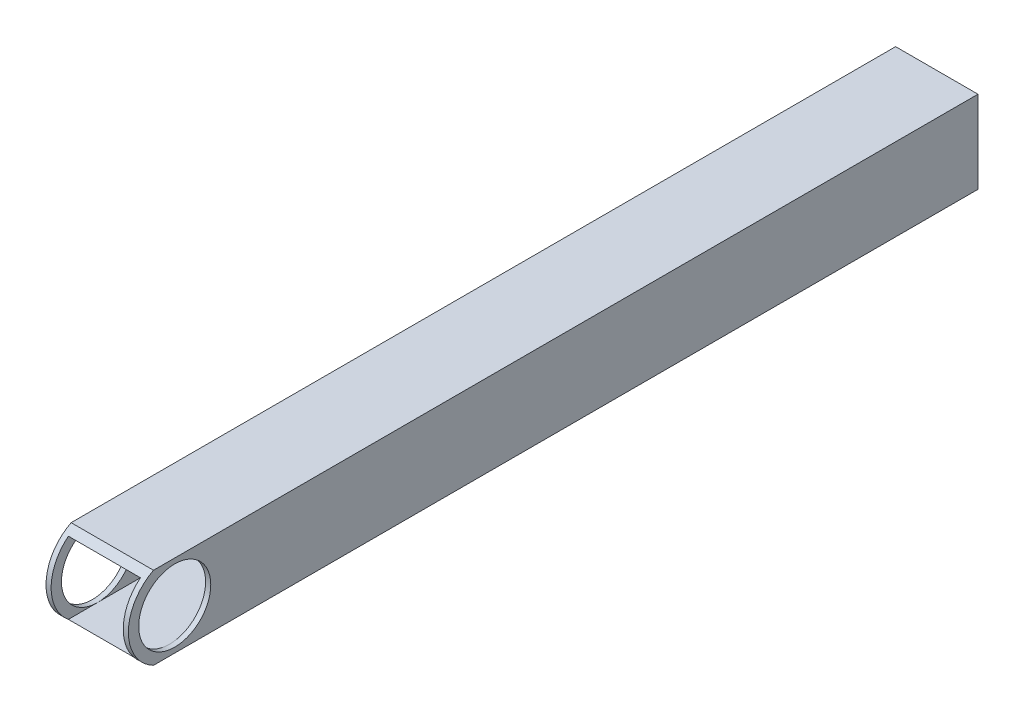
from build123d import *

# Parameters (mm, degrees)
SKETCH1_W           = 25.4
SKETCH1_H           = 25.4
SKETCH1_W_2         = 22.225
SKETCH1_H_2         = 22.225
EXTRUDE_THIN1_DEPTH = 133.35
SKETCH2_R           = 11.1125
CUT_EXTRUDE1_DEPTH  = 137.340282015
CUT_EXTRUDE2_DEPTH  = 137.340282015


with BuildPart() as part:
    # Sketch1 → Extrude-Thin1 (new, symmetric)
    with BuildSketch(Plane.XY):
        Rectangle(SKETCH1_W, SKETCH1_H)
        Rectangle(SKETCH1_W_2, SKETCH1_H_2, mode=Mode.SUBTRACT)
    extrude(amount=EXTRUDE_THIN1_DEPTH, both=True)

    # Sketch2 → Cut-Extrude1 (cut, through all)
    with BuildSketch(Plane(origin=(12.7, 0, 0), x_dir=(0, 0, -1), z_dir=(1, 0, 0))):
        with Locations((-114.3, 0)):
            Circle(SKETCH2_R)
    extrude(amount=-CUT_EXTRUDE1_DEPTH, mode=Mode.SUBTRACT)

    # Sketch3 → Cut-Extrude2 (cut, through all)
    with BuildSketch(Plane(origin=(12.7, 0, 0), x_dir=(0, 0, -1), z_dir=(1, 0, 0))):
        with BuildLine():
            Line((-114.3, 14.2875), (-133.35, 14.2875))
            Line((-133.35, 14.2875), (-133.35, -12.7))
            Line((-133.35, -12.7), (-120.845430181, -12.7))
            ThreePointArc((-120.845430181, -12.7), (-128.1849542, 3.367596045), (-114.3, 14.2875))
        make_face()
    extrude(amount=-CUT_EXTRUDE2_DEPTH, mode=Mode.SUBTRACT)


solid = part.part
